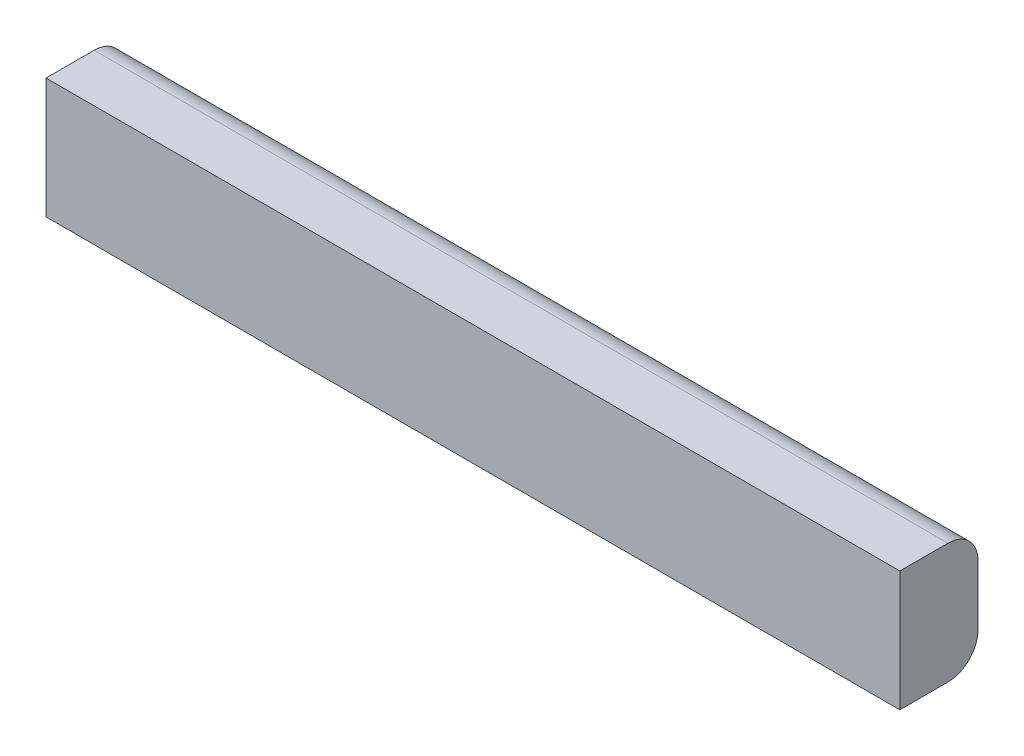
from build123d import *

# Parameters (mm, degrees)
BOSS_EXTRUDE1_DEPTH = 450.85


with BuildPart() as part:
    # Sketch1 → Boss-Extrude1 (new, symmetric)
    with BuildSketch(Plane(origin=(0, 0, 0), x_dir=(0, 0, -1), z_dir=(1, 0, 0))):
        with BuildLine():
            Line((49.373646209, 66.02166065), (-1.426353791, 66.02166065))
            Line((-1.426353791, 66.02166065), (-1.426353791, -60.97833935))
            Line((-1.426353791, -60.97833935), (49.373646209, -60.97833935))
            ThreePointArc((49.373646209, -60.97833935), (71.824286512, -51.678979653), (81.123646209, -29.22833935))
            Line((81.123646209, -29.22833935), (81.123646209, 34.27166065))
            ThreePointArc((81.123646209, 34.27166065), (71.824286512, 56.722300952), (49.373646209, 66.02166065))
        make_face()
    extrude(amount=BOSS_EXTRUDE1_DEPTH, both=True)


solid = part.part
